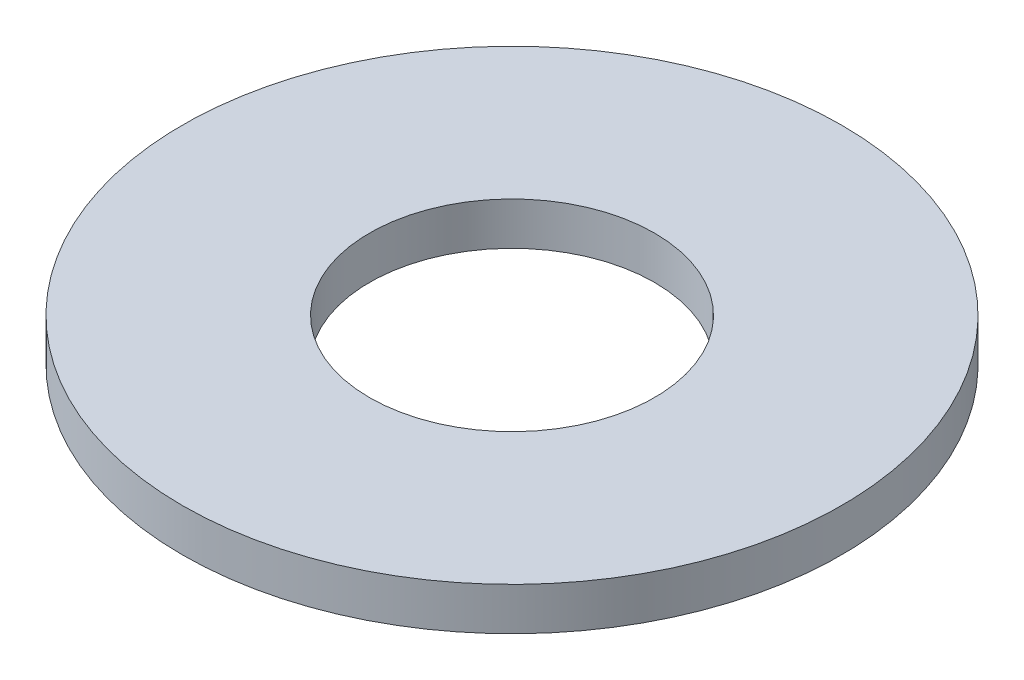
from build123d import *

# Parameters (mm, degrees)
SKETCH1_R           = 92.5
BOSS_EXTRUDE1_DEPTH = 12
SKETCH2_R           = 40
CUT_EXTRUDE1_DEPTH  = 132.363998112


with BuildPart() as part:
    # Sketch1 → Boss-Extrude1 (new body)
    with BuildSketch(Plane(origin=(0, 0, 0), x_dir=(1, 0, 0), z_dir=(0, 1, 0))):
        Circle(SKETCH1_R)
    extrude(amount=BOSS_EXTRUDE1_DEPTH)

    # Sketch2 → Cut-Extrude1 (cut, through all)
    with BuildSketch(Plane(origin=(0, 0, 0), x_dir=(1, 0, 0), z_dir=(0, 1, 0))):
        Circle(SKETCH2_R)
    extrude(amount=CUT_EXTRUDE1_DEPTH, mode=Mode.SUBTRACT)


solid = part.part
